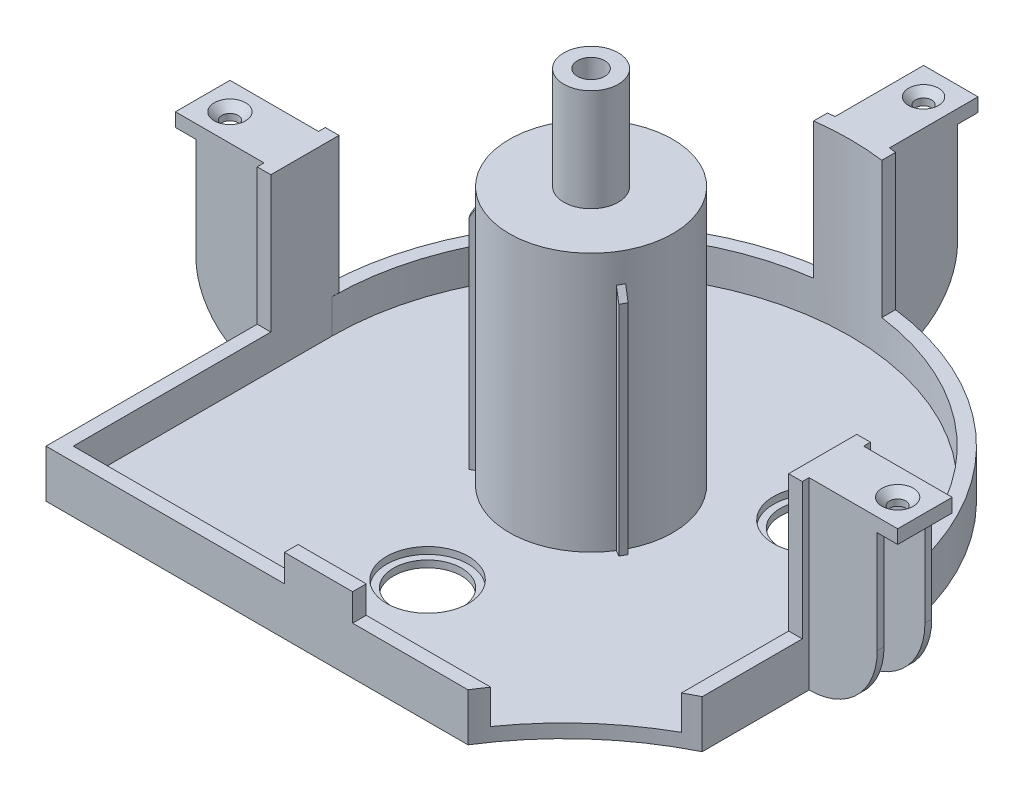
from build123d import *

# Parameters (mm, degrees)
BOSS_EXTRUDE2_DEPTH                                 = 7
SHELL3_T                                            = -2
SKETCH2_R                                           = 12
BOSS_EXTRUDE3_DEPTH                                 = 40
SKETCH3_R                                           = 4
BOSS_EXTRUDE4_DEPTH                                 = 15
SHELL4_START                                        = 2
SHELL4_OUTLINE_R                                    = 10
SHELL4_DEPTH                                        = 36
SHELL4_START_2                                      = 38
SHELL4_2_OUTLINE_R                                  = 2
SHELL4_2_DEPTH                                      = 17
RIB1_START                                          = -0.5
RIB1_DEPTH                                          = 1
CIRPATTERN1_COUNT                                   = 3
BOSS_EXTRUDE5_DEPTH                                 = 2
SKETCH29_R                                          = 44.999999999999986
CUT_EXTRUDE14_DEPTH                                 = 7
BOSS_EXTRUDE9_DEPTH                                 = 2
SKETCH32_R                                          = 10
CUT_EXTRUDE10_DEPTH                                 = 2
FILLET3_R                                           = 1
SKETCH35_R                                          = 5.000000000000003
CUT_EXTRUDE12_DEPTH                                 = 2
CIRPATTERN2_COUNT                                   = 3
SKETCH37_R                                          = 6.000000000000001
CUT_EXTRUDE13_DEPTH                                 = 1
CIRPATTERN3_COUNT                                   = 3
BOSS_EXTRUDE13_DEPTH                                = 20
BOSS_EXTRUDE14_DEPTH                                = 2
BOSS_EXTRUDE15_DEPTH                                = 1
LPATTERN4_COUNT                                     = 2
LPATTERN4_PITCH                                     = 7
FILLET4_R                                           = 10
CSK_FOR_M2_COUNTERSUNK_FLAT_HEAD_SCREW6_D           = 2.4
CSK_FOR_M2_COUNTERSUNK_FLAT_HEAD_SCREW6_CSINK_D     = 4.4
CSK_FOR_M2_COUNTERSUNK_FLAT_HEAD_SCREW6_CSINK_ANGLE = 90
BOSS_EXTRUDE16_DEPTH                                = 2
SKETCH68_W                                          = 10
SKETCH68_H                                          = 25.000000000000004
EXTRUDE_THIN1_DEPTH                                 = 1
LPATTERN5_COUNT                                     = 2
LPATTERN5_PITCH                                     = 7
LPATTERN6_COUNT                                     = 2
LPATTERN6_PITCH                                     = 78
LPATTERN7_COUNT                                     = 2
LPATTERN7_PITCH                                     = 93
LPATTERN8_COUNT                                     = 2
LPATTERN8_PITCH                                     = 90
LPATTERN8_COPY_1_SKETCH_W                           = 10
LPATTERN8_COPY_1_SKETCH_H                           = 25.000000000000004
LPATTERN8_COPY_1_DEPTH                              = 1
FILLET5_R                                           = 10
CSK_FOR_M2_FLAT_CROSS_HEAD_SCREW1_D                 = 2.4
CSK_FOR_M2_FLAT_CROSS_HEAD_SCREW1_CSINK_D           = 4.6
CSK_FOR_M2_FLAT_CROSS_HEAD_SCREW1_CSINK_ANGLE       = 92


# Read off the part's stored shape, not the designer's step: Shell4, Rib1
with BuildPart() as part:
    # Sketch1 → Boss-Extrude2 (new body)
    with BuildSketch(Plane(origin=(0, 0, 0), x_dir=(1, 0, 0), z_dir=(0, 1, 0))):
        with BuildLine():
            Line((40, 4.9e-15), (40.00000000000001, -40.00000000000001))
            Line((40.00000000000001, -40.00000000000001), (-40.00000000000001, -40.00000000000001))
            Line((-40.00000000000001, -40.00000000000001), (-40, 4.9e-15))
            ThreePointArc((-40, 4.9e-15), (-6.43e-15, 40), (40, 4.9e-15))
        make_face()
    extrude(amount=BOSS_EXTRUDE2_DEPTH)

    # Shell3
    shell3_openings = [part.faces().sort_by_distance(p)[0] for p in [
        (0, 7, 3.733994357),
    ]]
    offset(amount=SHELL3_T, openings=shell3_openings, kind=Kind.INTERSECTION)

    # Sketch2 → Boss-Extrude3 (add)
    with BuildSketch(Plane(origin=(0, 0, 0), x_dir=(1, 0, 0), z_dir=(0, 1, 0))):
        with Locations(Location((0, 0, 0), (0, 0, 270))):
            Circle(SKETCH2_R)
    extrude(amount=BOSS_EXTRUDE3_DEPTH)

    # Sketch3 → Boss-Extrude4 (add)
    with BuildSketch(Plane(origin=(0, 40, 0), x_dir=(1, 0, 0), z_dir=(0, 1, 0))):
        with Locations(Location((0, 0, 0), (0, 0, 270))):
            Circle(SKETCH3_R)
    extrude(amount=BOSS_EXTRUDE4_DEPTH)

    # Shell4 outline → Shell4 (cut)
    with BuildSketch(Plane(origin=(0, 0, 0), x_dir=(1, 0, 0), z_dir=(0, 1, 0)).offset(SHELL4_START)):
        Circle(SHELL4_OUTLINE_R)
    extrude(amount=SHELL4_DEPTH, mode=Mode.SUBTRACT)

    # Shell4 2 outline → Shell4 2 (cut)
    with BuildSketch(Plane(origin=(0, 0, 0), x_dir=(1, 0, 0), z_dir=(0, 1, 0)).offset(SHELL4_START_2)):
        Circle(SHELL4_2_OUTLINE_R)
    extrude(amount=SHELL4_2_DEPTH, mode=Mode.SUBTRACT)

    # Rib1 outline → Rib1 (add)
    with BuildSketch(Plane(origin=(0, 0, 0), x_dir=(0, 0, -1), z_dir=(1, 0, 0)).offset(RIB1_START)):
        Polygon((13, 34), (11.989578808, 35.750100841), (11.267949192, 37), (10, 37), (10, 1), (13, 1), align=None)
    rib1 = extrude(amount=RIB1_DEPTH)

    # CirPattern1: Rib1 ×3 about axis
    cirpattern1_axis = Axis((-5e-17, 0, 1.3e-15), (0, 1, 0))
    for i in range(1, CIRPATTERN1_COUNT):
        add(rib1.rotate(cirpattern1_axis, i * 360 / CIRPATTERN1_COUNT))

    # Sketch13 → Boss-Extrude5 (add)
    with BuildSketch(Plane(origin=(40, 0, -6.94e-15), x_dir=(0, 0, -1), z_dir=(1, 0, 0))):
        Polygon((0.9999999999999784, 7.0000000000000036), (0.9999999999999662, 27.000000000000004), (-9.000000000000014, 27), (-9.000000000000014, 7), (-40.000000000000014, 7), (-40.000000000000014, 0), (0, 0), (0, 7), align=None)
    boss_extrude5 = extrude(amount=-BOSS_EXTRUDE5_DEPTH)

    # Sketch29 → Cut-Extrude14 (cut)
    with BuildSketch(Plane(origin=(0, 0, 0), x_dir=(1, 0, 0), z_dir=(0, 1, 0))):
        with Locations((60.00000000000001, -64)):
            Circle(SKETCH29_R)
    extrude(amount=CUT_EXTRUDE14_DEPTH, mode=Mode.SUBTRACT)

    # Sketch31 → Boss-Extrude9 (add)
    with BuildSketch(Plane.XY.offset(40.00000000000001)):
        Polygon((5, 0), (5, 11), (-5.0000000000000036, 11), (-5, 0), align=None)
    extrude(amount=-BOSS_EXTRUDE9_DEPTH)

    # Sketch32 → Cut-Extrude10 (cut)
    with BuildSketch(Plane(origin=(0, 0, 0), x_dir=(1, 0, 0), z_dir=(0, 1, 0))):
        with Locations(Location((0, 0, 0), (0, 0, 270))):
            Circle(SKETCH32_R)
    extrude(amount=CUT_EXTRUDE10_DEPTH, mode=Mode.SUBTRACT)

    # Fillet3
    fillet3_edges = [part.edges().sort_by_distance(p)[0] for p in [
        (3.06e-15, 0, -10),
    ]]
    fillet(fillet3_edges, radius=FILLET3_R)

    # Sketch35 → Cut-Extrude12 (cut)
    with BuildSketch(Plane(origin=(0, 2, 0), x_dir=(1, 0, 0), z_dir=(0, 1, 0))):
        with Locations(Location((0, -24, 0), (0, 0, 270))):
            Circle(SKETCH35_R)
    cut_extrude12 = extrude(amount=-CUT_EXTRUDE12_DEPTH, mode=Mode.SUBTRACT)

    # CirPattern2: Cut-Extrude12 ×3 about axis
    cirpattern2_axis = Axis((-3.7e-16, 0, -1.37e-15), (0, 1, 0))
    for i in range(1, CIRPATTERN2_COUNT):
        add(cut_extrude12.rotate(cirpattern2_axis, i * 360 / CIRPATTERN2_COUNT), mode=Mode.SUBTRACT)

    # Sketch37 → Cut-Extrude13 (cut)
    with BuildSketch(Plane(origin=(0, 2, 0), x_dir=(1, 0, 0), z_dir=(0, 1, 0))):
        with Locations(Location((0, -24, 0), (0, 0, 270))):
            Circle(SKETCH37_R)
    cut_extrude13 = extrude(amount=-CUT_EXTRUDE13_DEPTH, mode=Mode.SUBTRACT)

    # CirPattern3: Cut-Extrude13 ×3 about axis
    cirpattern3_axis = Axis((3.7e-16, 0, -1.37e-15), (0, 1, 0))
    for i in range(1, CIRPATTERN3_COUNT):
        add(cut_extrude13.rotate(cirpattern3_axis, i * 360 / CIRPATTERN3_COUNT), mode=Mode.SUBTRACT)

    # Sketch61 → Boss-Extrude13 (add)
    with BuildSketch(Plane(origin=(0, 7, 0), x_dir=(1, 0, 0), z_dir=(0, 1, 0))):
        with BuildLine():
            Line((5, 39.68626966596886), (5.000000000000001, 37.66961640367472))
            ThreePointArc((5.000000000000001, 37.66961640367472), (2.33e-15, 38), (-5, 37.66961640367472))
            Line((-5, 37.66961640367472), (-5, 39.68626966596886))
            ThreePointArc((-5, 39.68626966596886), (2.45e-15, 40), (5, 39.68626966596886))
        make_face()
    extrude(amount=BOSS_EXTRUDE13_DEPTH)



with BuildPart() as body_2:
    # Sketch62 → Boss-Extrude14 (new body)
    with BuildSketch(Plane(origin=(0, 27, 0), x_dir=(1, 0, 0), z_dir=(0, 1, 0))):
        with BuildLine():
            Line((-3.9891832676658594, 52.80058312207215), (-3.9891832676658594, 39.800583122072155))
            ThreePointArc((-3.9891832676658567, 39.800583122072155), (2.45e-15, 40), (3.9891832676658616, 39.800583122072155))
            Line((3.9891832676658594, 39.800583122072155), (3.9891832676658594, 52.80058312207215))
            Line((3.9891832676658594, 52.80058312207215), (-3.9891832676658594, 52.80058312207215))
        make_face()
    extrude(amount=-BOSS_EXTRUDE14_DEPTH)


with BuildPart() as part_1:
    add(part.part)

    add(body_2.part)  # Boss-Extrude15 merges body 2
    # Sketch63 → Boss-Extrude15 (add)
    with BuildSketch(Plane(origin=(3.9891832676658594, 0, 0), x_dir=(0, 0, -1), z_dir=(1, 0, 0))):
        Polygon((49.800583122072155, 25), (49.800583122072155, 9.75e-15), (40, 0), (39.80058312207216, 0), (39.80058312207216, 25), align=None)
    boss_extrude15 = extrude(amount=-BOSS_EXTRUDE15_DEPTH)

    # LPattern4: Boss-Extrude15 ×2
    with Locations(*[(-i * LPATTERN4_PITCH, 0, 0) for i in range(1, LPATTERN4_COUNT)]):
        add(boss_extrude15)

    # Fillet4
    fillet4_edges = [part_1.edges().sort_by_distance(p)[0] for p in [
        (-3.5108167323341406, 9.75e-15, -49.800583122072155),
    ]]
    fillet(fillet4_edges, radius=FILLET4_R)

    # CSK for M2 Countersunk Flat Head Screw6 (through all)
    with Locations(Plane(origin=(0, 27, 0), x_dir=(1, 0, 0), z_dir=(0, 1, 0))):
        with Locations((0, 48.800583122)):
            CounterSinkHole(CSK_FOR_M2_COUNTERSUNK_FLAT_HEAD_SCREW6_D / 2, CSK_FOR_M2_COUNTERSUNK_FLAT_HEAD_SCREW6_CSINK_D / 2, counter_sink_angle=CSK_FOR_M2_COUNTERSUNK_FLAT_HEAD_SCREW6_CSINK_ANGLE)

    # Sketch67 → Boss-Extrude16 (add)
    with BuildSketch(Plane(origin=(0, 27.000000000000004, 9.37e-15), x_dir=(1, 0, 0), z_dir=(0, 1, 3.5e-16))):
        Polygon((40, -8.67e-15), (53, -8.67e-15), (53, -4.000000000000009), (53, -8.000000000000009), (40, -8.000000000000009), align=None)
    boss_extrude16 = extrude(amount=-BOSS_EXTRUDE16_DEPTH)

    # Sketch68 → Extrude-Thin1 (add)
    with BuildSketch(Plane.XY.offset(8.000000000000009)):
        with Locations((45.00000000000001, 12.500000000000002)):
            Rectangle(SKETCH68_W, SKETCH68_H)
    extrude_thin1 = extrude(amount=-EXTRUDE_THIN1_DEPTH)

    # LPattern5: Extrude-Thin1 ×2
    with Locations(*[(0, 0, -i * LPATTERN5_PITCH) for i in range(1, LPATTERN5_COUNT)]):
        add(extrude_thin1)

    # LPattern6: Boss-Extrude5 ×2
    with Locations(*[(-i * LPATTERN6_PITCH, 0, 0) for i in range(1, LPATTERN6_COUNT)]):
        add(boss_extrude5)

    # LPattern7: Boss-Extrude16 ×2
    with Locations(*[(-i * LPATTERN7_PITCH, 0, 0) for i in range(1, LPATTERN7_COUNT)]):
        add(boss_extrude16)

    # LPattern8: Extrude-Thin1 ×2
    with Locations(*[(-i * LPATTERN8_PITCH, 0, 0) for i in range(1, LPATTERN8_COUNT)]):
        add(extrude_thin1)

    # LPattern8 copy 1 sketch → LPattern8 copy 1 (add)
    with BuildSketch(Plane(origin=(-90, -2.78e-15, 0.9999999999999929), x_dir=(1, 0, 0), z_dir=(0, 0, 1))):
        with Locations((45.00000000000001, 12.500000000000002)):
            Rectangle(LPATTERN8_COPY_1_SKETCH_W, LPATTERN8_COPY_1_SKETCH_H)
    extrude(amount=-LPATTERN8_COPY_1_DEPTH)

    # Fillet5
    fillet5_edges = [part_1.edges().sort_by_distance(p)[0] for p in [
        (-49.99999999999999, -2.8e-15, 7.499999999999993),
        (-49.99999999999999, -2.8e-15, 0.4999999999999929),
        (50.00000000000001, -2.8e-15, 7.500000000000009),
        (50.00000000000001, -2.8e-15, 0.5000000000000089),
    ]]
    fillet(fillet5_edges, radius=FILLET5_R)

    # CSK for M2 Flat Cross Head Screw1 (through all)
    with Locations(Plane(origin=(0, 27.000000000000004, 9.37e-15), x_dir=(1, 0, 0), z_dir=(0, 1, 3.5e-16))):
        with Locations((49, -4), (-49, -4)):
            CounterSinkHole(CSK_FOR_M2_FLAT_CROSS_HEAD_SCREW1_D / 2, CSK_FOR_M2_FLAT_CROSS_HEAD_SCREW1_CSINK_D / 2, counter_sink_angle=CSK_FOR_M2_FLAT_CROSS_HEAD_SCREW1_CSINK_ANGLE)


solid = part_1.part
